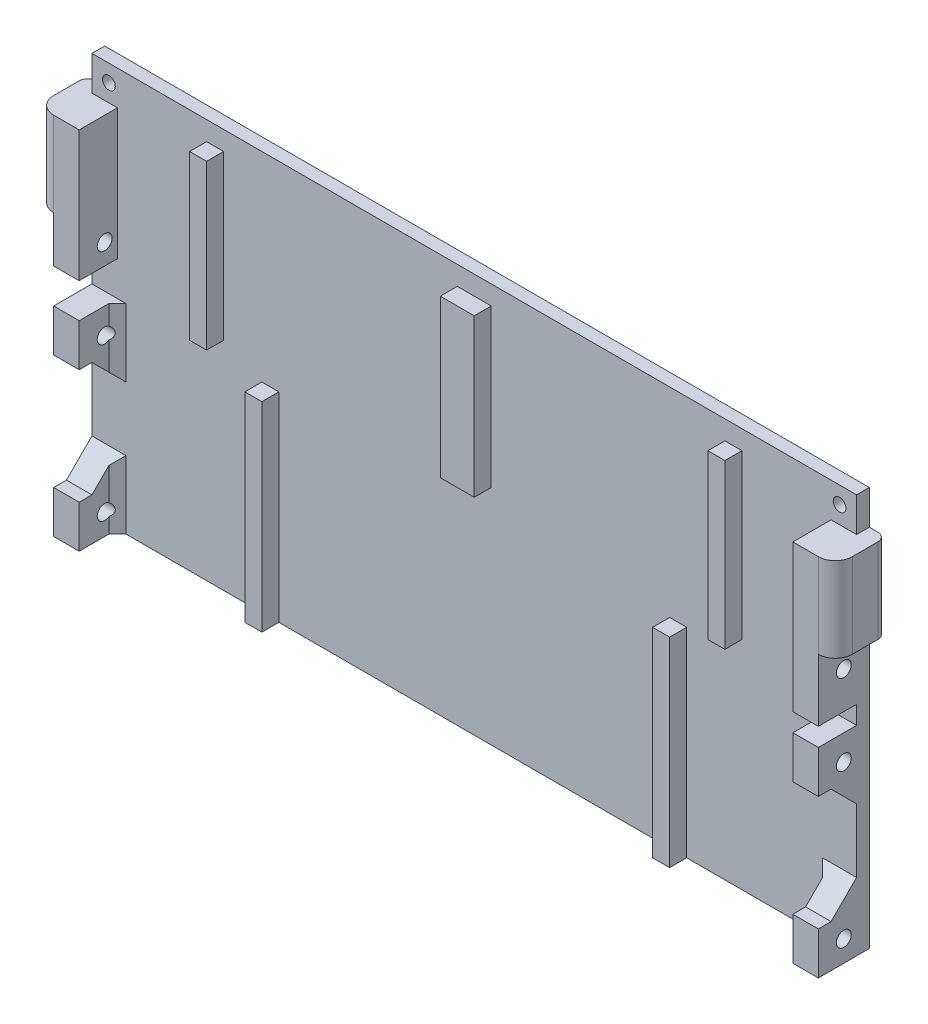
from build123d import *

# Parameters (mm, degrees)
SKETCH_1_W          = 180
SKETCH_1_H          = 94
EXTRUDE_1_DEPTH     = 3
SKETCH_2_W          = 6
SKETCH_2_H          = 10
SKETCH_2_H_2        = 34.6
SKETCH_2_H_3        = 30.754035876
EXTRUDE_2_DEPTH     = 9
CHAMFER_2_SIZE      = 6
CHAMFER_1_SIZE      = 6
SKETCH_3_R          = 1.75
CUT_EXTRUDE_1_DEPTH = 204.420746238
SKETCH_4_R          = 1.5
CUT_EXTRUDE_2_DEPTH = 204.265835791
SKETCH_5_W          = 4
SKETCH_5_H          = 47
SKETCH_5_H_2        = 38.5
SKETCH_5_W_2        = 8
SKETCH_5_H_3        = 37
EXTRUDE_3_DEPTH     = 4
CHAMFER_3_SIZE      = 2
SKETCH_6_W          = 12
SKETCH_6_H          = 19.9
EXTRUDE_4_DEPTH     = 4
FILLET_1_R          = 4
SKETCH_7_W          = 12
SKETCH_7_H          = 19.9
EXTRUDE_5_DEPTH     = 4
FILLET_2_R          = 4
FILLET_3_R          = 2


with BuildPart() as part:
    # Эскиз1 → Бобышка-Вытянуть1 (new body)
    with BuildSketch(Plane.XY):
        with Locations((90, -47)):
            Rectangle(SKETCH_1_W, SKETCH_1_H)
    extrude(amount=EXTRUDE_1_DEPTH)

    # Эскиз2 → Бобышка-Вытянуть2 (add)
    with BuildSketch(Plane.XY.offset(3)):
        with Locations((3, -89)):
            Rectangle(SKETCH_2_W, SKETCH_2_H)
        with Locations((177, -89)):
            Rectangle(SKETCH_2_W, SKETCH_2_H)
        with Locations((3, -52)):
            Rectangle(SKETCH_2_W, SKETCH_2_H)
        with Locations((177, -52)):
            Rectangle(SKETCH_2_W, SKETCH_2_H)
        with Locations((177, -25.4)):
            Rectangle(SKETCH_2_W, SKETCH_2_H_2)
        with Locations((3, -23.477017938)):
            Rectangle(SKETCH_2_W, SKETCH_2_H_3)
    extrude(amount=EXTRUDE_2_DEPTH)

    # Фаска2
    chamfer_2_edges = [part.edges().sort_by_distance(p)[0] for p in [
        (3, -57, 3),
        (177, -57, 3),
    ]]
    chamfer(chamfer_2_edges, length=CHAMFER_2_SIZE)

    # Фаска1
    chamfer_1_edges = [part.edges().sort_by_distance(p)[0] for p in [
        (3, -84, 3),
        (177, -84, 3),
    ]]
    chamfer(chamfer_1_edges, length=CHAMFER_1_SIZE)

    # Эскиз3 → Вырез-Вытянуть1 (cut, through all)
    with BuildSketch(Plane(origin=(180, 0, 0), x_dir=(0, 0, -1), z_dir=(1, 0, 0))):
        with Locations((-6, -89)):
            Circle(SKETCH_3_R)
        with Locations((-6, -53)):
            Circle(SKETCH_3_R)
        with Locations((-6, -34)):
            Circle(SKETCH_3_R)
    extrude(amount=-CUT_EXTRUDE_1_DEPTH, mode=Mode.SUBTRACT)

    # Эскиз4 → Вырез-Вытянуть2 (cut, through all)
    with BuildSketch(Plane.XY.offset(3)):
        with Locations((4, -4)):
            Circle(SKETCH_4_R)
        with Locations((176, -4)):
            Circle(SKETCH_4_R)
    extrude(amount=-CUT_EXTRUDE_2_DEPTH, mode=Mode.SUBTRACT)

    # Эскиз5 → Бобышка-Вытянуть3 (add)
    with BuildSketch(Plane.XY.offset(3)):
        with Locations((42, -70.5)):
            Rectangle(SKETCH_5_W, SKETCH_5_H)
        with Locations((138, -70.5)):
            Rectangle(SKETCH_5_W, SKETCH_5_H)
        with Locations((29, -23.75)):
            Rectangle(SKETCH_5_W, SKETCH_5_H_2)
        with Locations((151, -23.75)):
            Rectangle(SKETCH_5_W, SKETCH_5_H_2)
        with Locations((90, -23)):
            Rectangle(SKETCH_5_W_2, SKETCH_5_H_3)
    extrude(amount=EXTRUDE_3_DEPTH)

    # Фаска3
    # the kernel refuses this chamfer: 2 mm, written as the material it adds along each edge
    with BuildSketch(Plane(origin=(6, -72.856634024, 3), x_dir=(0.9996219169112968, 0, -0.02749587661058627), z_dir=(0, -1, 0))) as chamfer_3_piece_1_section:
        Polygon((CHAMFER_3_SIZE * 0.999621916911, CHAMFER_3_SIZE * 0.0274958766106), (-CHAMFER_3_SIZE * 0.0274958766106, CHAMFER_3_SIZE * 0.999621916911), (0, 0), align=None)
    chamfer_3_piece_1 = extrude(amount=21.143365976, mode=Mode.PRIVATE)
    chamfer_3_piece_1 = split(chamfer_3_piece_1, bisect_by=Plane(origin=(6.680922071, -82.46162584, 7.46162584), z_dir=(0, -0.7071067811865476, -0.7071067811865476)), keep=Keep.TOP, mode=Mode.PRIVATE)
    chamfer_3_piece_1 = chamfer_3_piece_1 - Plane(origin=(6.680922071, -89, 6), x_dir=(0, 0, -1), z_dir=(1, 0, 0)) * Cylinder(1.75, 51, mode=Mode.PRIVATE)
    add(chamfer_3_piece_1)
    with BuildSketch(Plane(origin=(174, -94, 3), x_dir=(-0.9996219169112968, 0, -0.02749587661058639), z_dir=(0, 1, 0))) as chamfer_3_piece_2_section:
        Polygon((CHAMFER_3_SIZE * 0.999621916911, CHAMFER_3_SIZE * 0.0274958766106), (-CHAMFER_3_SIZE * 0.0274958766106, CHAMFER_3_SIZE * 0.999621916911), (0, 0), align=None)
    chamfer_3_piece_2 = extrude(amount=21.143365976, mode=Mode.PRIVATE)
    chamfer_3_piece_2 = split(chamfer_3_piece_2, bisect_by=Plane(origin=(173.319077929, -82.46162584, 7.46162584), z_dir=(0, -0.7071067811865476, -0.7071067811865476)), keep=Keep.TOP, mode=Mode.PRIVATE)
    chamfer_3_piece_2 = chamfer_3_piece_2 - Plane(origin=(173.319077929, -89, 6), x_dir=(0, 0, -1), z_dir=(1, 0, 0)) * Cylinder(1.75, 51, mode=Mode.PRIVATE)
    add(chamfer_3_piece_2)
    with BuildSketch(Plane(origin=(6, -47, 3), x_dir=(0.9996219169112968, 0, -0.02749587661058627), z_dir=(0, -1, 0))) as chamfer_3_piece_3_section:
        Polygon((CHAMFER_3_SIZE * 0.999621916911, CHAMFER_3_SIZE * 0.0274958766106), (-CHAMFER_3_SIZE * 0.0274958766106, CHAMFER_3_SIZE * 0.999621916911), (0, 0), align=None)
    chamfer_3_piece_3 = extrude(amount=21.143365976, mode=Mode.PRIVATE)
    chamfer_3_piece_3 = split(chamfer_3_piece_3, bisect_by=Plane(origin=(6.680922071, -58.530709151, 7.469290849), z_dir=(0, 0.7071067811865476, -0.7071067811865476)), keep=Keep.TOP, mode=Mode.PRIVATE)
    chamfer_3_piece_3 = chamfer_3_piece_3 - Plane(origin=(6.680922071, -53, 6), x_dir=(0, 0, -1), z_dir=(1, 0, 0)) * Cylinder(1.75, 51, mode=Mode.PRIVATE)
    add(chamfer_3_piece_3)
    with BuildSketch(Plane(origin=(174, -68.143365976, 3), x_dir=(-0.9996219169112968, 0, -0.02749587661058639), z_dir=(0, 1, 0))) as chamfer_3_piece_4_section:
        Polygon((CHAMFER_3_SIZE * 0.999621916911, CHAMFER_3_SIZE * 0.0274958766106), (-CHAMFER_3_SIZE * 0.0274958766106, CHAMFER_3_SIZE * 0.999621916911), (0, 0), align=None)
    chamfer_3_piece_4 = extrude(amount=21.143365976, mode=Mode.PRIVATE)
    chamfer_3_piece_4 = split(chamfer_3_piece_4, bisect_by=Plane(origin=(173.319077929, -58.530709151, 7.469290849), z_dir=(0, 0.7071067811865476, -0.7071067811865476)), keep=Keep.TOP, mode=Mode.PRIVATE)
    chamfer_3_piece_4 = chamfer_3_piece_4 - Plane(origin=(173.319077929, -53, 6), x_dir=(0, 0, -1), z_dir=(1, 0, 0)) * Cylinder(1.75, 51, mode=Mode.PRIVATE)
    add(chamfer_3_piece_4)

    # Эскиз6 → Бобышка-Вытянуть4 (add)
    with BuildSketch(Plane(origin=(180, 0, 0), x_dir=(0, 0, -1), z_dir=(1, 0, 0))):
        with Locations((-6, -18.05)):
            Rectangle(SKETCH_6_W, SKETCH_6_H)
    extrude(amount=EXTRUDE_4_DEPTH)

    # Скругление1
    fillet_1_edges = [part.edges().sort_by_distance(p)[0] for p in [
        (184, -18.05, 12),
    ]]
    fillet(fillet_1_edges, radius=FILLET_1_R)

    # Эскиз7 → Бобышка-Вытянуть5 (add)
    with BuildSketch(Plane.ZY):
        with Locations((6, -18.05)):
            Rectangle(SKETCH_7_W, SKETCH_7_H)
    extrude(amount=EXTRUDE_5_DEPTH)

    # Скругление2
    fillet_2_edges = [part.edges().sort_by_distance(p)[0] for p in [
        (-4, -18.05, 12),
    ]]
    fillet(fillet_2_edges, radius=FILLET_2_R)

    # Скругление3
    fillet_3_edges = [part.edges().sort_by_distance(p)[0] for p in [
        (184, -18.05, 0),
        (-4, -18.05, 0),
    ]]
    fillet(fillet_3_edges, radius=FILLET_3_R)


solid = part.part
